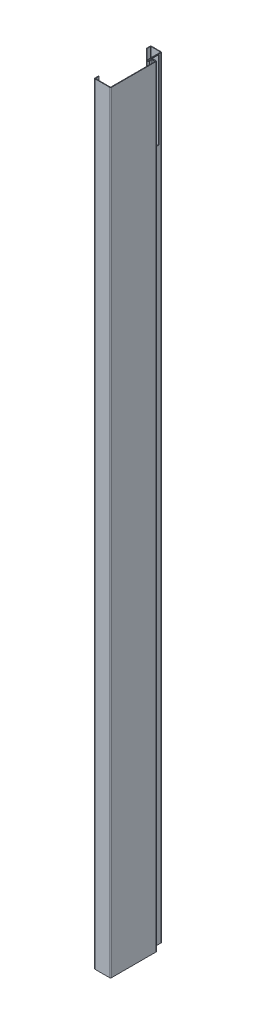
from build123d import *

# Parameters (mm, degrees)
BASE_FLANGE1_DEPTH     = 1050
CUT_EXTRUDE3_START     = 835
CUT_EXTRUDE3_OUTLINE_W = 1.5
CUT_EXTRUDE3_OUTLINE_H = 23
CUT_EXTRUDE3_DEPTH     = 213


# Read off the part's stored shape, not the designer's step: Cut-Extrude3
# Sheet-metal steps are written as plain solids
with BuildPart() as part:
    # Sketch1 → Base-Flange1 (new, symmetric)
    with BuildSketch(Plane(origin=(0, 0, 0), x_dir=(1, 0, 0), z_dir=(0, 1, 0))):
        with BuildLine():
            Line((9.5, 65), (9.5, 74.7634))
            ThreePointArc((9.5, 74.7634), (10.155084973, 76.344915027), (11.7366, 77))
            Line((11.7366, 77), (37.2634, 77))
            ThreePointArc((37.2634, 77), (38.844915027, 76.344915027), (39.5, 74.7634))
            Line((39.5, 74.7634), (39.5, 49))
            Line((39.5, 49), (39.5, 38.8))
            ThreePointArc((39.5, 38.8), (41.269678139, 37.091041686), (42.915834526, 38.91928357))
            Line((42.915834526, 38.91928357), (42.378230266, 46.607382671))
            ThreePointArc((42.378230266, 46.607382671), (42.973636332, 48.288757532), (44.609382021, 49))
            Line((44.609382021, 49), (51.7634, 49))
            ThreePointArc((51.7634, 49), (53.344915027, 48.344915027), (54, 46.7634))
            Line((54, 46.7634), (54, -30))
            Line((54, -30), (54, -74.7634))
            ThreePointArc((54, -74.7634), (53.344915027, -76.344915027), (51.7634, -77))
            Line((51.7634, -77), (39.5, -77))
            Line((39.5, -77), (11.7366, -77))
            ThreePointArc((11.7366, -77), (10.155084973, -76.344915027), (9.5, -74.7634))
            Line((9.5, -74.7634), (9.5, -65))
            Line((9.5, -65), (11, -65))
            Line((11, -65), (11, -74.7634))
            ThreePointArc((11, -74.7634), (11.215745145, -75.284254855), (11.7366, -75.5))
            Line((11.7366, -75.5), (39.5, -75.5))
            Line((39.5, -75.5), (51.7634, -75.5))
            ThreePointArc((51.7634, -75.5), (52.284254855, -75.284254855), (52.5, -74.7634))
            Line((52.5, -74.7634), (52.5, -30))
            Line((52.5, -30), (52.5, 46.7634))
            ThreePointArc((52.5, 46.7634), (52.284254855, 47.284254855), (51.7634, 47.5))
            Line((51.7634, 47.5), (44.609382021, 47.5))
            ThreePointArc((44.609382021, 47.5), (44.070666884, 47.265759992), (43.874576341, 46.712017381))
            Line((43.874576341, 46.712017381), (44.412180601, 39.023918281))
            ThreePointArc((44.412180601, 39.023918281), (41.322027384, 35.591955445), (38, 38.8))
            Line((38, 38.8), (38, 49))
            Line((38, 49), (38, 74.7634))
            ThreePointArc((38, 74.7634), (37.784254855, 75.284254855), (37.2634, 75.5))
            Line((37.2634, 75.5), (11.7366, 75.5))
            ThreePointArc((11.7366, 75.5), (11.215745145, 75.284254855), (11, 74.7634))
            Line((11, 74.7634), (11, 65))
            Line((11, 65), (9.5, 65))
        make_face()
    extrude(amount=BASE_FLANGE1_DEPTH, both=True)

    # Cut-Extrude3 outline → Cut-Extrude3 (cut)
    with BuildSketch(Plane(origin=(0, 0, 0), x_dir=(1, 0, 0), z_dir=(0, 1, 0)).offset(CUT_EXTRUDE3_START)):
        with Locations((38.75, 57.5)):
            Rectangle(CUT_EXTRUDE3_OUTLINE_W, CUT_EXTRUDE3_OUTLINE_H)
        with BuildLine():
            Line((48, 47.5), (48, 49))
            Line((48, 49), (44.609382021, 49))
            ThreePointArc((44.609382021, 49), (42.973636332, 48.288757532), (42.378230266, 46.607382671))
            Line((42.378230266, 46.607382671), (42.428019372, 45.895365289))
            Line((42.428019372, 45.895365289), (43.924365447, 46))
            Line((43.924365447, 46), (43.874576341, 46.712017381))
            ThreePointArc((43.874576341, 46.712017381), (44.070666884, 47.265759992), (44.609382021, 47.5))
            Line((44.609382021, 47.5), (48, 47.5))
        make_face()
    extrude(amount=CUT_EXTRUDE3_DEPTH, mode=Mode.SUBTRACT)


solid = part.part
